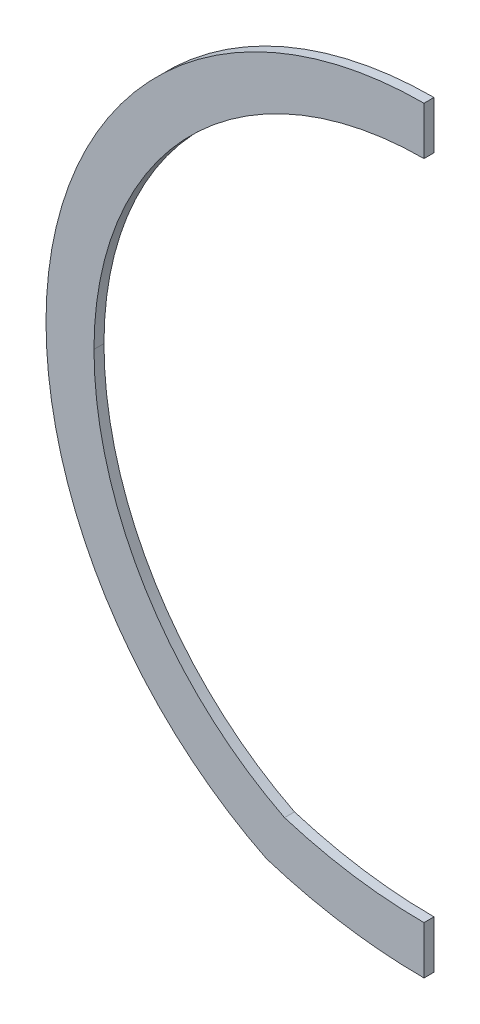
from build123d import *

# Parameters (mm, degrees)
BOSS_EXTRUDE1_DEPTH = 1.5875
SKETCH3_W           = 208.645691316
SKETCH3_H           = 383.026987577
CUT_EXTRUDE1_DEPTH  = 184.927178997


with BuildPart() as part:
    # Sketch2 → Boss-Extrude1 (new, symmetric)
    with BuildSketch(Plane.XY):
        with BuildLine():
            ThreePointArc((-120.098895727, 19.05), (0.406748907, 139.2017743), (120.203613722, 18.343301545))
            ThreePointArc((120.203613722, 18.343301545), (101.067699546, -47.629728931), (50.138751442, -93.726))
            ThreePointArc((50.138751442, -93.726), (0.040174098, -101.514794876), (-50.058403246, -93.726))
            ThreePointArc((-50.058403246, -93.726), (-101.163912713, -47.327889321), (-120.098895727, 19.05))
        make_face()
        with BuildLine():
            ThreePointArc((-104.858895727, 19.05), (0.361930242, 123.961840203), (104.963877332, 18.432938489))
            ThreePointArc((104.963877332, 18.432938489), (88.446745877, -39.065849025), (44.40486057, -79.553359885))
            ThreePointArc((44.40486057, -79.553359885), (0.040463589, -86.274794876), (-44.323959374, -79.553531384))
            ThreePointArc((-44.323959374, -79.553531384), (-88.517658334, -38.801393502), (-104.858895727, 19.05))
        make_face(mode=Mode.SUBTRACT)
    extrude(amount=BOSS_EXTRUDE1_DEPTH, both=True)

    # Sketch3 → Cut-Extrude1 (cut, through all)
    with BuildSketch(Plane(origin=(0, 0, 0), x_dir=(0, 0, -1), z_dir=(1, 0, 0))):
        with Locations((4.266053154, 20.866300598)):
            Rectangle(SKETCH3_W, SKETCH3_H)
    extrude(amount=CUT_EXTRUDE1_DEPTH, mode=Mode.SUBTRACT)


solid = part.part
